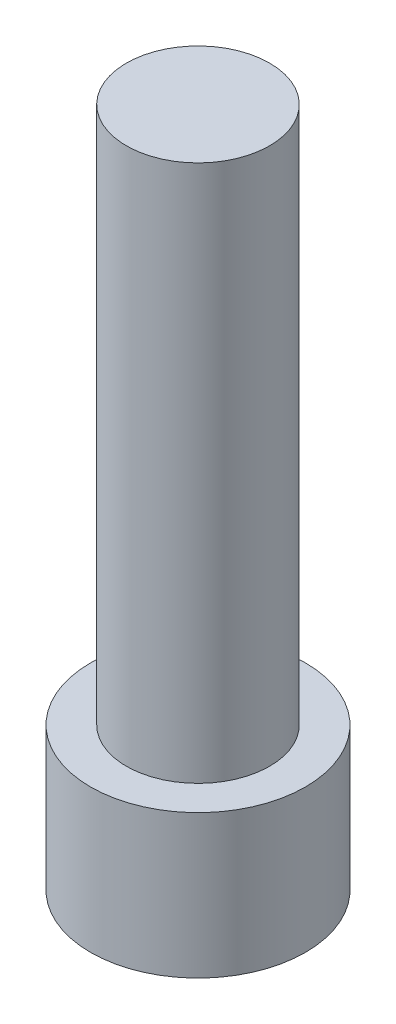
from build123d import *

# Parameters (mm, degrees)
SKETCH1_R           = 9
BOSS_EXTRUDE1_DEPTH = 12
SKETCH2_R           = 6
BOSS_EXTRUDE2_DEPTH = 45


with BuildPart() as part:
    # Sketch1 → Boss-Extrude1 (new body)
    with BuildSketch(Plane(origin=(0, 0, 0), x_dir=(1, 0, 0), z_dir=(0, 1, 0))):
        Circle(SKETCH1_R)
    extrude(amount=BOSS_EXTRUDE1_DEPTH)

    # Sketch2 → Boss-Extrude2 (add)
    with BuildSketch(Plane(origin=(0, 12, 0), x_dir=(1, 0, 0), z_dir=(0, 1, 0))):
        Circle(SKETCH2_R)
    extrude(amount=BOSS_EXTRUDE2_DEPTH)


solid = part.part
